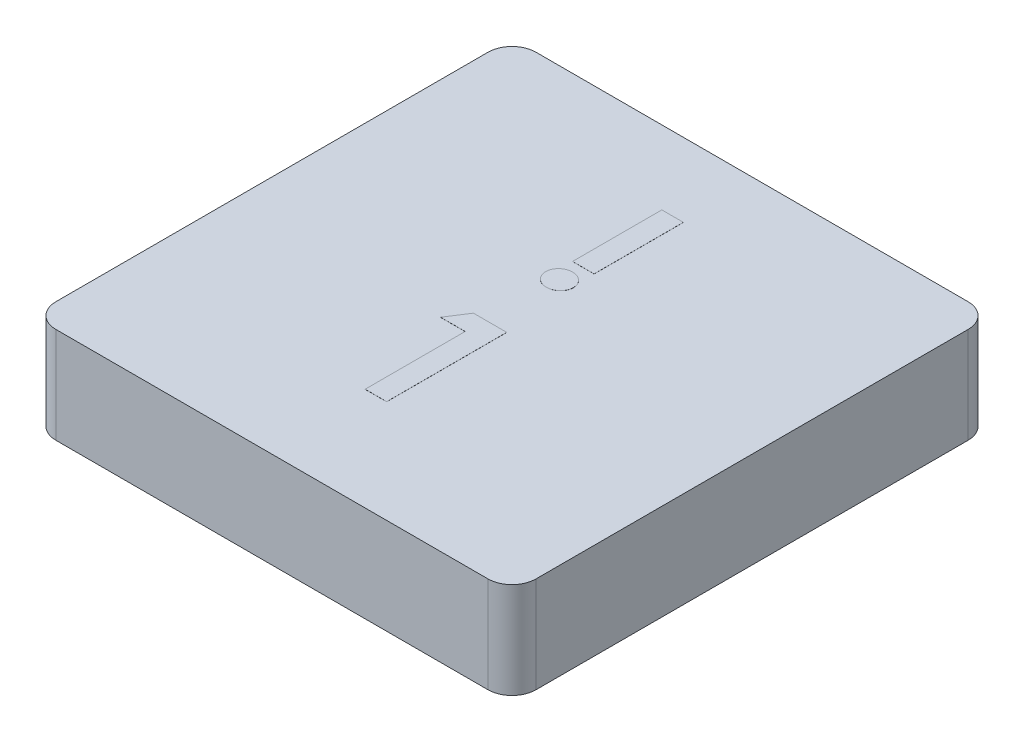
from build123d import *

# Parameters (mm, degrees)
SKETCH1_W           = 12.7
SKETCH1_H           = 12.7
BOSS_EXTRUDE1_DEPTH = 2.54
FILLET1_R           = 0.635
SHELL1_START        = 0.635
SHELL1_OUTLINE_W    = 1.905
SHELL1_OUTLINE_H    = 11.43
SHELL1_DEPTH        = 11.43
SKETCH2_R           = 2.54
BOSS_EXTRUDE2_DEPTH = 1.905
SKETCH4_W           = 0.569871795
SKETCH4_H           = 2.360897435
BOSS_EXTRUDE4_DEPTH = 0.00254


# Read off the part's stored shape, not the designer's step: Shell1
with BuildPart() as part:
    # Sketch1 → Boss-Extrude1 (new body)
    with BuildSketch(Plane(origin=(0, 0, 0), x_dir=(1, 0, 0), z_dir=(0, 1, 0))):
        with Locations((6.35, 6.35)):
            Rectangle(SKETCH1_W, SKETCH1_H)
    extrude(amount=BOSS_EXTRUDE1_DEPTH)

    # Fillet1
    fillet1_edges = [part.edges().sort_by_distance(p)[0] for p in [
        (0, 1.27, -12.7),
        (12.7, 1.27, -12.7),
        (12.7, 1.27, 0),
        (0, 1.27, 0),
    ]]
    fillet(fillet1_edges, radius=FILLET1_R)

    # Shell1 outline → Shell1 (cut)
    with BuildSketch(Plane.YZ.offset(SHELL1_START)):
        with Locations((0.9525, -6.35)):
            Rectangle(SHELL1_OUTLINE_W, SHELL1_OUTLINE_H)
    extrude(amount=SHELL1_DEPTH, mode=Mode.SUBTRACT)

    # Sketch2 → Boss-Extrude2 (add)
    with BuildSketch(Plane(origin=(0, 1.905, 0), x_dir=(-1, 0, 0), z_dir=(0, -1, 0))):
        with Locations(Location((-6.35, 6.35, 0), (0, 0, 270))):
            Circle(SKETCH2_R)
    extrude(amount=BOSS_EXTRUDE2_DEPTH)

    # Sketch4 → Boss-Extrude4 (add)
    with BuildSketch(Plane(origin=(0, 2.54, 0), x_dir=(1, 0, 0), z_dir=(0, 1, 0))):
        Polygon((5.786615585, 5.8928), (6.6675, 5.8928), (6.6675, 2.7178), (6.097628205, 2.7178), (6.097628205, 5.363633333), (5.446346154, 5.363633333), align=None)
        with Locations((6.198576924, 9.568961539)):
            Rectangle(SKETCH4_W, SKETCH4_H)
        with BuildLine():
            add(Edge.make_bspline(
                [(6.15659976, 8.144282051), (6.181114846, 8.14312519), (6.229230135, 8.14085464), (6.29812647, 8.121024719), (6.361621628, 8.089242855), (6.417346825, 8.044829654), (6.46419376, 7.991918171), (6.49981086, 7.932762932), (6.520119015, 7.866987217), (6.522831135, 7.821531669), (6.524217949, 7.798288462)],
                knots=[0, 0, 0, 0, 1.047809347, 2.056515231, 3.042961894, 4.070764251, 5.086916663, 6.055238644, 7.005567131, 8, 8, 8, 8], degree=3))
            add(Edge.make_bspline(
                [(6.524217949, 7.798288462), (6.522848775, 7.775246677), (6.520171202, 7.730185882), (6.499493652, 7.664808308), (6.464419974, 7.605386122), (6.417343309, 7.552346714), (6.36145253, 7.508102773), (6.298310565, 7.475398921), (6.229206258, 7.455769722), (6.181106787, 7.453467746), (6.15659976, 7.452294872)],
                knots=[0, 0, 0, 0, 0.986108588, 1.928446017, 2.905307005, 3.922188024, 4.95072734, 5.942010196, 6.951439348, 8, 8, 8, 8], degree=3))
            add(Edge.make_bspline(
                [(6.15659976, 7.452294872), (6.132065206, 7.453390455), (6.084320726, 7.455522472), (6.015889475, 7.476010263), (5.952393573, 7.506934534), (5.897132108, 7.551827553), (5.850818591, 7.604659288), (5.816038507, 7.663993601), (5.795588521, 7.729569639), (5.792900256, 7.775038465), (5.791525641, 7.798288462)],
                knots=[0, 0, 0, 0, 1.051359956, 2.045956662, 3.043883966, 4.068025705, 5.0816239, 6.04864862, 7.002197394, 8, 8, 8, 8], degree=3))
            add(Edge.make_bspline(
                [(5.791525641, 7.798288462), (5.792900256, 7.821538458), (5.795588521, 7.867007284), (5.816038507, 7.932583322), (5.850818591, 7.991917636), (5.897132108, 8.04474937), (5.952393573, 8.089642389), (6.015889475, 8.12056666), (6.084320726, 8.141054451), (6.132065206, 8.143186468), (6.15659976, 8.144282051)],
                knots=[0, 0, 0, 0, 0.997802606, 1.95135138, 2.9183761, 3.931974295, 4.956116034, 5.954043338, 6.948640044, 8, 8, 8, 8], degree=3))
        make_face()
    extrude(amount=BOSS_EXTRUDE4_DEPTH)


solid = part.part
